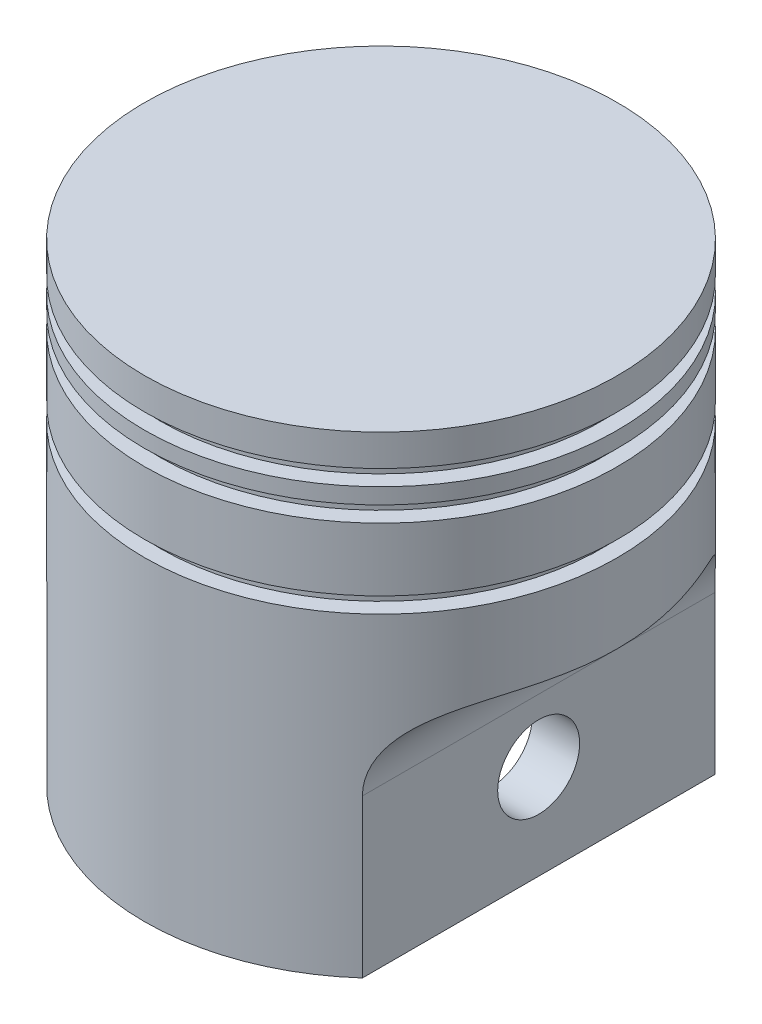
from build123d import *

# Parameters (mm, degrees)
SKETCH1_R               = 15
BOSS_EXTRUDE1_DEPTH     = 30
CUT_EXTRUDE3_DEPTH      = 37.742346142
CUT_EXTRUDE3_DEPTH_BACK = 37.742346142
SKETCH5_W               = 5
SKETCH5_H               = 15
CUT_EXTRUDE5_START      = -10
SKETCH6_R               = 15
CUT_EXTRUDE5_DEPTH      = 10
SKETCH6_4_R             = 14
BOSS_EXTRUDE2_DEPTH     = 10
SKETCH6_5_R             = 15
SKETCH6_5_R_2           = 14
BOSS_EXTRUDE3_DEPTH     = 9
SKETCH6_6_R             = 15
SKETCH6_6_R_2           = 14
CUT_EXTRUDE6_DEPTH      = 5
SKETCH6_7_R             = 15
SKETCH6_7_R_2           = 14
BOSS_EXTRUDE4_DEPTH     = 4
SKETCH6_8_R             = 15
SKETCH6_8_R_2           = 14
CUT_EXTRUDE7_DEPTH      = 3
SKETCH6_9_R             = 15
SKETCH6_9_R_2           = 14
BOSS_EXTRUDE5_DEPTH     = 2
SHELL2_DEPTH            = 27
SHELL2_START            = 18
SHELL2_2_DEPTH          = 9
SHELL2_3_DEPTH          = 17
CUT_EXTRUDE2_DEPTH      = 37.742346142
CUT_EXTRUDE2_DEPTH_BACK = 37.742346142
SKETCH4_R               = 2.6
FILLET1_R               = 5


# Read off the part's stored shape, not the designer's step: Shell2
with BuildPart() as part:
    # Sketch1 → Boss-Extrude1 (new body)
    with BuildSketch(Plane(origin=(0, 0, 0), x_dir=(1, 0, 0), z_dir=(0, 1, 0))):
        with Locations(Location((0, 0, 0), (0, 0, 270))):
            Circle(SKETCH1_R)
    extrude(amount=BOSS_EXTRUDE1_DEPTH)

    # Sketch5 → Cut-Extrude3 (cut, two sides: drawn at the far end of the back side and taken through both)
    with BuildSketch(Plane.XY.offset(-CUT_EXTRUDE3_DEPTH_BACK)):
        with Locations((-12.5, 7.5)):
            Rectangle(SKETCH5_W, SKETCH5_H)
        with Locations((12.5, 7.5)):
            Rectangle(SKETCH5_W, SKETCH5_H)
    extrude(amount=CUT_EXTRUDE3_DEPTH + CUT_EXTRUDE3_DEPTH_BACK, mode=Mode.SUBTRACT)

    # Sketch6 → Cut-Extrude5 (cut)
    with BuildSketch(Plane(origin=(0, 30, 0), x_dir=(1, 0, 0), z_dir=(0, 1, 0)).offset(CUT_EXTRUDE5_START)):
        with Locations(Location((0, 0, 0), (0, 0, 48.189685104))):
            Circle(SKETCH6_R)
    extrude(amount=CUT_EXTRUDE5_DEPTH, mode=Mode.SUBTRACT)

    # Sketch6<4> → Boss-Extrude2 (add)
    with BuildSketch(Plane(origin=(0, 30, 0), x_dir=(1, 0, 0), z_dir=(0, 1, 0))):
        with Locations(Location((0, 0, 0), (0, 0, 270))):
            Circle(SKETCH6_4_R)
    extrude(amount=-BOSS_EXTRUDE2_DEPTH)

    # Sketch6<5> → Boss-Extrude3 (add)
    with BuildSketch(Plane(origin=(0, 30, 0), x_dir=(1, 0, 0), z_dir=(0, 1, 0))):
        with Locations(Location((0, 0, 0), (0, 0, 48.189685104))):
            Circle(SKETCH6_5_R)
        with Locations(Location((0, 0, 0), (0, 0, 270))):
            Circle(SKETCH6_5_R_2, mode=Mode.SUBTRACT)
    extrude(amount=-BOSS_EXTRUDE3_DEPTH)

    # Sketch6<6> → Cut-Extrude6 (cut)
    with BuildSketch(Plane(origin=(0, 30, 0), x_dir=(1, 0, 0), z_dir=(0, 1, 0))):
        with Locations(Location((0, 0, 0), (0, 0, 270))):
            Circle(SKETCH6_6_R)
        with Locations(Location((0, 0, 0), (0, 0, 270))):
            Circle(SKETCH6_6_R_2, mode=Mode.SUBTRACT)
    extrude(amount=-CUT_EXTRUDE6_DEPTH, mode=Mode.SUBTRACT)

    # Sketch6<7> → Boss-Extrude4 (add)
    with BuildSketch(Plane(origin=(0, 30, 0), x_dir=(1, 0, 0), z_dir=(0, 1, 0))):
        with Locations(Location((0, 0, 0), (0, 0, 270))):
            Circle(SKETCH6_7_R)
        with Locations(Location((0, 0, 0), (0, 0, 270))):
            Circle(SKETCH6_7_R_2, mode=Mode.SUBTRACT)
    extrude(amount=-BOSS_EXTRUDE4_DEPTH)

    # Sketch6<8> → Cut-Extrude7 (cut)
    with BuildSketch(Plane(origin=(0, 30, 0), x_dir=(1, 0, 0), z_dir=(0, 1, 0))):
        with Locations(Location((0, 0, 0), (0, 0, 270))):
            Circle(SKETCH6_8_R)
        with Locations(Location((0, 0, 0), (0, 0, 270))):
            Circle(SKETCH6_8_R_2, mode=Mode.SUBTRACT)
    extrude(amount=-CUT_EXTRUDE7_DEPTH, mode=Mode.SUBTRACT)

    # Sketch6<9> → Boss-Extrude5 (add)
    with BuildSketch(Plane(origin=(0, 30, 0), x_dir=(1, 0, 0), z_dir=(0, 1, 0))):
        with Locations(Location((0, 0, 0), (0, 0, 270))):
            Circle(SKETCH6_9_R)
        with Locations(Location((0, 0, 0), (0, 0, 270))):
            Circle(SKETCH6_9_R_2, mode=Mode.SUBTRACT)
    extrude(amount=-BOSS_EXTRUDE5_DEPTH)

    # Shell2 outline → Shell2 (cut)
    with BuildSketch(Plane(origin=(0, 0, 0), x_dir=(1, 0, 0), z_dir=(0, 1, 0))):
        with BuildLine():
            Line((7, -8.485281374), (7, 8.485281374))
            ThreePointArc((7, 8.485281374), (0, 11), (-7, 8.485281374))
            Line((-7, 8.485281374), (-7, -8.485281374))
            ThreePointArc((-7, -8.485281374), (0, -11), (7, -8.485281374))
        make_face()
    extrude(amount=SHELL2_DEPTH, mode=Mode.SUBTRACT)

    # Shell2 2 outline → Shell2 2 (cut)
    with BuildSketch(Plane(origin=(0, 0, 0), x_dir=(1, 0, 0), z_dir=(0, 1, 0)).offset(SHELL2_START)):
        with BuildLine():
            ThreePointArc((7, -8.485281374), (11, 0), (7, 8.485281374))
            Line((7, 8.485281374), (7, -8.485281374))
        make_face()
        with BuildLine():
            Line((-7, -8.485281374), (-7, 8.485281374))
            ThreePointArc((-7, 8.485281374), (-11, 0), (-7, -8.485281374))
        make_face()
    extrude(amount=SHELL2_2_DEPTH, mode=Mode.SUBTRACT)

    # Shell2 3 outline → Shell2 3 (cut)
    with BuildSketch(Plane(origin=(0, 0, 0), x_dir=(1, 0, 0), z_dir=(0, 1, 0))):
        with BuildLine():
            ThreePointArc((-7, 8.485281374), (0, 11), (7, 8.485281374))
            Line((7, 8.485281374), (7, 9.746794345))
            ThreePointArc((7, 9.746794345), (0, 12), (-7, 9.746794345))
            Line((-7, 9.746794345), (-7, 8.485281374))
        make_face()
        with BuildLine():
            Line((7, -9.746794345), (7, -8.485281374))
            ThreePointArc((7, -8.485281374), (0, -11), (-7, -8.485281374))
            Line((-7, -8.485281374), (-7, -9.746794345))
            ThreePointArc((-7, -9.746794345), (0, -12), (7, -9.746794345))
        make_face()
    extrude(amount=SHELL2_3_DEPTH, mode=Mode.SUBTRACT)

    # Sketch4 → Cut-Extrude2 (cut, two sides: drawn at the far end of the back side and taken through both)
    with BuildSketch(Plane(origin=(0, 0, 0), x_dir=(0, 0, -1), z_dir=(1, 0, 0)).offset(-CUT_EXTRUDE2_DEPTH_BACK)):
        with Locations(Location((0, 6, 0), (0, 0, 180))):
            Circle(SKETCH4_R)
    extrude(amount=CUT_EXTRUDE2_DEPTH + CUT_EXTRUDE2_DEPTH_BACK, mode=Mode.SUBTRACT)

    # Fillet1
    fillet1_edges = [part.edges().sort_by_distance(p)[0] for p in [
        (10, 15, 0),
        (-10, 15, 0),
    ]]
    fillet(fillet1_edges, radius=FILLET1_R - 0.0001)  # a hair under: the kernel refuses the full size


solid = part.part
